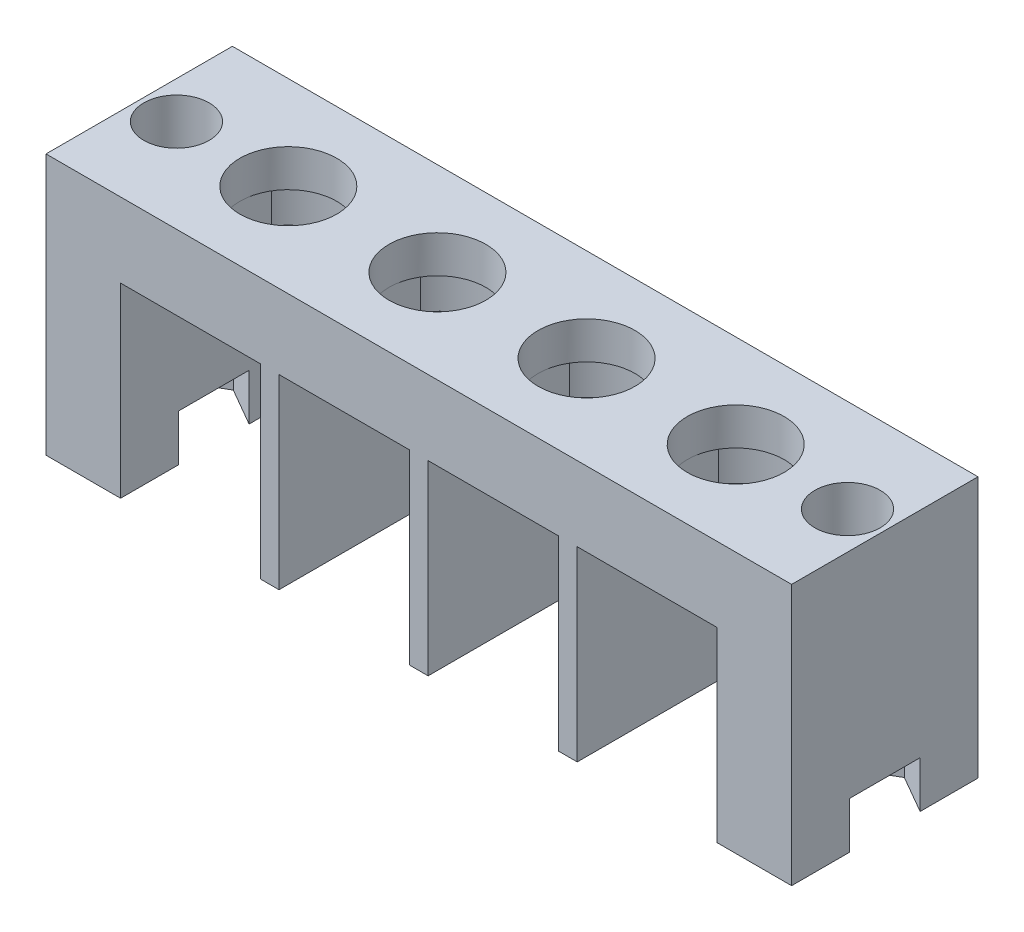
from build123d import *

# Parameters (mm, degrees)
SKETCH1_W           = 40
SKETCH1_H           = 10
BOSS_EXTRUDE1_DEPTH = 4
SKETCH2_R           = 2.6
CUT_EXTRUDE1_DEPTH  = 10
CUT_EXTRUDE4_DEPTH  = 2
BOSS_EXTRUDE4_DEPTH = 10
SKETCH6_R           = 1.75
CUT_EXTRUDE5_DEPTH  = 40
CUT_EXTRUDE6_DEPTH  = 2.5


with BuildPart() as part:
    # Sketch1 → Boss-Extrude1 (new body)
    with BuildSketch(Plane(origin=(0, 0, 0), x_dir=(1, 0, 0), z_dir=(0, 1, 0))):
        with Locations((-5, -2.382550336)):
            Rectangle(SKETCH1_W, SKETCH1_H)
    extrude(amount=BOSS_EXTRUDE1_DEPTH)

    # Sketch2 → Cut-Extrude1 (cut)
    with BuildSketch(Plane(origin=(0, 4, 0), x_dir=(1, 0, 0), z_dir=(0, 1, 0))):
        with Locations((-17, -2.382550336)):
            Circle(SKETCH2_R)
        with Locations((-9, -2.382550336)):
            Circle(SKETCH2_R)
        with Locations((-1, -2.382550336)):
            Circle(SKETCH2_R)
        with Locations((7, -2.382550336)):
            Circle(SKETCH2_R)
    extrude(amount=-CUT_EXTRUDE1_DEPTH, mode=Mode.SUBTRACT)

    # Sketch3 → Cut-Extrude4 (cut)
    with BuildSketch(Plane.XZ):
        with BuildLine():
            Line((-19.6, 4.070744637), (-19.6, 0.694356034))
            ThreePointArc((-19.6, 0.694356034), (-13.9, 2.382550336), (-19.6, 4.070744637))
        make_face()
        with BuildLine():
            Line((-11.6, 4.070744637), (-11.6, 0.694356034))
            ThreePointArc((-11.6, 0.694356034), (-5.9, 2.382550336), (-11.6, 4.070744637))
        make_face()
        with BuildLine():
            Line((-3.6, 4.070744637), (-3.6, 0.694356034))
            ThreePointArc((-3.6, 0.694356034), (2.1, 2.382550336), (-3.6, 4.070744637))
        make_face()
        with BuildLine():
            Line((4.4, 4.070744637), (4.4, 0.694356034))
            ThreePointArc((4.4, 0.694356034), (10.1, 2.382550336), (4.4, 4.070744637))
        make_face()
    extrude(amount=-CUT_EXTRUDE4_DEPTH, mode=Mode.SUBTRACT)

    # Sketch5 → Boss-Extrude4 (add)
    with BuildSketch(Plane.XZ):
        Polygon((-25, -1.617449664), (-25, -2.617449664), (15, -2.617449664), (15, -1.617449664), (15, 7.382550336), (11, 7.382550336), (11, -1.617449664), (3.5, -1.617449664), (3.5, 7.382550336), (2.5, 7.382550336), (2.5, -1.617449664), (-4.5, -1.617449664), (-4.5, 7.382550336), (-5.5, 7.382550336), (-5.5, -1.617449664), (-12.5, -1.617449664), (-12.5, 7.382550336), (-13.5, 7.382550336), (-13.5, -1.617449664), (-21, -1.617449664), (-21, 7.382550336), (-25, 7.382550336), align=None)
    extrude(amount=BOSS_EXTRUDE4_DEPTH)

    # Sketch6 → Cut-Extrude5 (cut)
    with BuildSketch(Plane.XZ.offset(10)):
        with Locations((-23, 2.382550336)):
            Circle(SKETCH6_R)
        with Locations((13, 2.382550336)):
            Circle(SKETCH6_R)
    extrude(amount=-CUT_EXTRUDE5_DEPTH, mode=Mode.SUBTRACT)

    # Sketch8 → Cut-Extrude6 (cut)
    with BuildSketch(Plane.XZ.offset(10)):
        Polygon((13, 5.432550336), (10.358622518, 3.907550336), (10.358622518, 0.857550336), (13, -0.667449664), (15.641377482, 0.857550336), (15.641377482, 3.907550336), align=None)
        Polygon((-23, 5.432550336), (-25.641377482, 3.907550336), (-25.641377482, 0.857550336), (-23, -0.667449664), (-20.358622518, 0.857550336), (-20.358622518, 3.907550336), align=None)
    extrude(amount=-CUT_EXTRUDE6_DEPTH, mode=Mode.SUBTRACT)


solid = part.part
